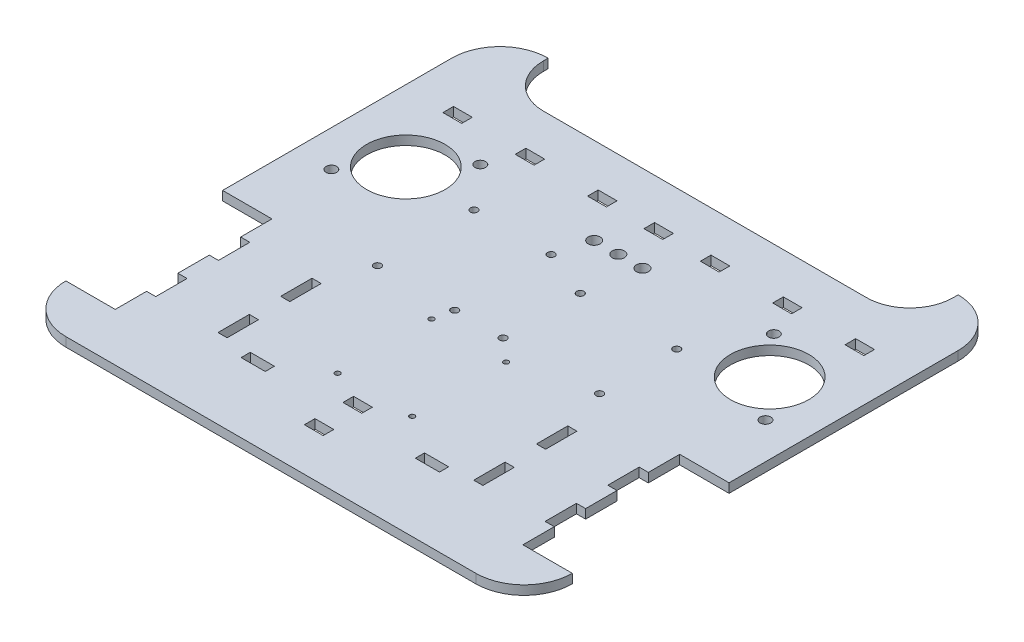
from build123d import *

# Parameters (mm, degrees)
SKETCH1_W           = 266.7
SKETCH1_H           = 254
BOSS_EXTRUDE1_DEPTH = 4.826
SKETCH2_W           = 26.00000007
SKETCH2_H           = 82.55
CUT_EXTRUDE1_DEPTH  = 4.826
CUT_EXTRUDE3_DEPTH  = 4.826
SKETCH7_W           = 215.9
SKETCH7_H           = 25.4
CUT_EXTRUDE5_DEPTH  = 4.826
FILLET9_R           = 22.86
FILLET10_R          = 22.86
CUT_EXTRUDE6_DEPTH  = 4.826
SKETCH10_W          = 4.826
SKETCH10_H          = 16.51
CUT_EXTRUDE8_DEPTH  = 185.213226387
SKETCH12_W          = 4.826
SKETCH12_H          = 16.51
CUT_EXTRUDE9_DEPTH  = 185.213226387
SKETCH13_W          = 4.826
SKETCH13_H          = 16.51
CUT_EXTRUDE10_DEPTH = 185.213226387
SKETCH15_R          = 1.3462
CUT_EXTRUDE11_DEPTH = 185.213226387
SKETCH16_R          = 2.778125
SKETCH16_R_2        = 20.6375
CUT_EXTRUDE12_DEPTH = 185.213226387
SKETCH17_W          = 9.906
SKETCH17_H          = 5.588
CUT_EXTRUDE13_DEPTH = 185.213226387
SKETCH18_W          = 9.906
SKETCH18_H          = 5.588
CUT_EXTRUDE14_DEPTH = 185.213226387
SKETCH19_R          = 3.175
CUT_EXTRUDE15_DEPTH = 185.213226387
SKETCH20_R          = 1.905
CUT_EXTRUDE16_DEPTH = 185.213226387
SKETCH21_R          = 1.905
CUT_EXTRUDE17_DEPTH = 185.213226387
SKETCH22_W          = 12.7
SKETCH22_H          = 4.826
CUT_EXTRUDE18_DEPTH = 185.213226387


with BuildPart() as part:
    # Sketch1 → Boss-Extrude1 (new body)
    with BuildSketch(Plane(origin=(0, 0, 0), x_dir=(1, 0, 0), z_dir=(0, 1, 0))):
        Rectangle(SKETCH1_W, SKETCH1_H)
    extrude(amount=BOSS_EXTRUDE1_DEPTH)

    # Sketch2 → Cut-Extrude1 (cut)
    with BuildSketch(Plane(origin=(0, 4.826, 0), x_dir=(1, 0, 0), z_dir=(0, 1, 0))):
        with Locations((-120.349999965, -60.325)):
            Rectangle(SKETCH2_W, SKETCH2_H)
        with Locations((120.349999965, -60.325)):
            Rectangle(SKETCH2_W, SKETCH2_H)
    extrude(amount=-CUT_EXTRUDE1_DEPTH, mode=Mode.SUBTRACT)

    # Sketch4 → Cut-Extrude3 (cut)
    with BuildSketch(Plane(origin=(0, 4.826, 0), x_dir=(1, 0, 0), z_dir=(0, 1, 0))):
        with BuildLine():
            Line((-133.35, 101.6), (-133.35, 127))
            Line((-133.35, 127), (-107.95, 127))
            ThreePointArc((-107.95, 127), (-125.910512242, 119.560512242), (-133.35, 101.6))
        make_face()
        with BuildLine():
            Line((133.35, 101.6), (133.35, 127))
            Line((133.35, 127), (107.95, 127))
            ThreePointArc((107.95, 127), (125.910512242, 119.560512242), (133.35, 101.6))
        make_face()
    extrude(amount=-CUT_EXTRUDE3_DEPTH, mode=Mode.SUBTRACT)

    # Sketch7 → Cut-Extrude5 (cut)
    with BuildSketch(Plane(origin=(0, 4.826, 0), x_dir=(1, 0, 0), z_dir=(0, 1, 0))):
        with Locations((0, 114.3)):
            Rectangle(SKETCH7_W, SKETCH7_H)
    extrude(amount=-CUT_EXTRUDE5_DEPTH, mode=Mode.SUBTRACT)

    # Fillet9
    fillet9_edges = [part.edges().sort_by_distance(p)[0] for p in [
        (-107.95, 2.413, -101.6),
    ]]
    fillet(fillet9_edges, radius=FILLET9_R)

    # Fillet10
    fillet10_edges = [part.edges().sort_by_distance(p)[0] for p in [
        (107.95, 2.413, -101.6),
    ]]
    fillet(fillet10_edges, radius=FILLET10_R)

    # Sketch8 → Cut-Extrude6 (cut)
    with BuildSketch(Plane(origin=(0, 4.826, 0), x_dir=(1, 0, 0), z_dir=(0, 1, 0))):
        with BuildLine():
            Line((-133.35, -101.6), (-133.35, -127))
            Line((-133.35, -127), (-107.95, -127))
            ThreePointArc((-107.95, -127), (-125.910512242, -119.560512242), (-133.35, -101.6))
        make_face()
        with BuildLine():
            Line((133.35, -127), (107.95, -127))
            ThreePointArc((107.95, -127), (125.910512242, -119.560512242), (133.35, -101.6))
            Line((133.35, -101.6), (133.35, -127))
        make_face()
    extrude(amount=-CUT_EXTRUDE6_DEPTH, mode=Mode.SUBTRACT)

    # Sketch10 → Cut-Extrude8 (cut, through all)
    with BuildSketch(Plane(origin=(0, 4.826, 0), x_dir=(1, 0, 0), z_dir=(0, 1, 0))):
        with Locations((-104.93699993, -76.835)):
            Rectangle(SKETCH10_W, SKETCH10_H)
        with Locations((-104.93699993, -43.815)):
            Rectangle(SKETCH10_W, SKETCH10_H)
        with Locations((104.93699993, -43.815)):
            Rectangle(SKETCH10_W, SKETCH10_H)
        with Locations((104.93699993, -76.835)):
            Rectangle(SKETCH10_W, SKETCH10_H)
    extrude(amount=-CUT_EXTRUDE8_DEPTH, mode=Mode.SUBTRACT)

    # Sketch12 → Cut-Extrude9 (cut, through all)
    with BuildSketch(Plane.XZ):
        with Locations((-67.34499993, 76.835)):
            Rectangle(SKETCH12_W, SKETCH12_H)
        with Locations((-67.34499993, 43.815)):
            Rectangle(SKETCH12_W, SKETCH12_H)
    extrude(amount=-CUT_EXTRUDE9_DEPTH, mode=Mode.SUBTRACT)

    # Sketch13 → Cut-Extrude10 (cut, through all)
    with BuildSketch(Plane(origin=(0, 4.826, 0), x_dir=(1, 0, 0), z_dir=(0, 1, 0))):
        with Locations((67.34499993, -76.835)):
            Rectangle(SKETCH13_W, SKETCH13_H)
        with Locations((67.34499993, -43.815)):
            Rectangle(SKETCH13_W, SKETCH13_H)
    extrude(amount=-CUT_EXTRUDE10_DEPTH, mode=Mode.SUBTRACT)

    # Sketch15 → Cut-Extrude11 (cut, through all)
    with BuildSketch(Plane(origin=(0, 4.826, 0), x_dir=(1, 0, 0), z_dir=(0, 1, 0))):
        with Locations((19.5961, -22.730838906)):
            Circle(SKETCH15_R)
        with Locations((-19.6723, -22.730838906)):
            Circle(SKETCH15_R)
        with Locations((-19.6723, -72.163561094)):
            Circle(SKETCH15_R)
        with Locations((19.5961, -72.163561094)):
            Circle(SKETCH15_R)
    extrude(amount=-CUT_EXTRUDE11_DEPTH, mode=Mode.SUBTRACT)

    # Sketch16 → Cut-Extrude12 (cut, through all)
    with BuildSketch(Plane(origin=(0, 4.826, 0), x_dir=(1, 0, 0), z_dir=(0, 1, 0))):
        with Locations((77.293854564, 60.610218612)):
            Circle(SKETCH16_R)
        with Locations((114.3, 19.164632523)):
            Circle(SKETCH16_R)
        with Locations((95.796927282, 39.887425568)):
            Circle(SKETCH16_R_2)
        with Locations((-95.796927282, 39.887425568)):
            Circle(SKETCH16_R_2)
        with Locations((-77.293854564, 60.610218612)):
            Circle(SKETCH16_R)
        with Locations((-114.3, 19.164632523)):
            Circle(SKETCH16_R)
    extrude(amount=-CUT_EXTRUDE12_DEPTH, mode=Mode.SUBTRACT)

    # Sketch17 → Cut-Extrude13 (cut, through all)
    with BuildSketch(Plane(origin=(0, 4.826, 0), x_dir=(1, 0, 0), z_dir=(0, 1, 0))):
        with Locations((-67.795869789, 77.244822677)):
            Rectangle(SKETCH17_W, SKETCH17_H)
        with Locations((-105.895869789, 77.244822677)):
            Rectangle(SKETCH17_W, SKETCH17_H)
        with Locations((-29.695869789, 77.244822677)):
            Rectangle(SKETCH17_W, SKETCH17_H)
        with Locations((0, 77.244822677)):
            Rectangle(SKETCH17_W, SKETCH17_H)
        with Locations((29.695869789, 77.244822677)):
            Rectangle(SKETCH17_W, SKETCH17_H)
        with Locations((67.795869789, 77.244822677)):
            Rectangle(SKETCH17_W, SKETCH17_H)
        with Locations((105.895869789, 77.244822677)):
            Rectangle(SKETCH17_W, SKETCH17_H)
    extrude(amount=-CUT_EXTRUDE13_DEPTH, mode=Mode.SUBTRACT)

    # Sketch18 → Cut-Extrude14 (cut, through all)
    with BuildSketch(Plane(origin=(0, 4.826, 0), x_dir=(1, 0, 0), z_dir=(0, 1, 0))):
        with Locations((0, -101.6)):
            Rectangle(SKETCH18_W, SKETCH18_H)
        with Locations((0, -81.28)):
            Rectangle(SKETCH18_W, SKETCH18_H)
    extrude(amount=-CUT_EXTRUDE14_DEPTH, mode=Mode.SUBTRACT)

    # Sketch19 → Cut-Extrude15 (cut, through all)
    with BuildSketch(Plane(origin=(0, 4.826, 0), x_dir=(1, 0, 0), z_dir=(0, 1, 0))):
        with Locations((0, 55.982011538)):
            Circle(SKETCH19_R)
        with Locations((12.7, 55.982011538)):
            Circle(SKETCH19_R)
        with Locations((-12.7, 55.982011538)):
            Circle(SKETCH19_R)
    extrude(amount=-CUT_EXTRUDE15_DEPTH, mode=Mode.SUBTRACT)

    # Sketch20 → Cut-Extrude16 (cut, through all)
    with BuildSketch(Plane(origin=(0, 4.826, 0), x_dir=(1, 0, 0), z_dir=(0, 1, 0))):
        with Locations((-58.243854564, 38.202011538)):
            Circle(SKETCH20_R)
        with Locations((-17.603854564, 38.202011538)):
            Circle(SKETCH20_R)
        with Locations((-58.243854564, -12.597988462)):
            Circle(SKETCH20_R)
        with Locations((-17.603854564, -12.597988462)):
            Circle(SKETCH20_R)
    extrude(amount=-CUT_EXTRUDE16_DEPTH, mode=Mode.SUBTRACT)

    # Sketch21 → Cut-Extrude17 (cut, through all)
    with BuildSketch(Plane(origin=(0, 4.826, 0), x_dir=(1, 0, 0), z_dir=(0, 1, 0))):
        with Locations((7.796145436, 28.154731738)):
            Circle(SKETCH21_R)
        with Locations((58.596145436, 28.154731738)):
            Circle(SKETCH21_R)
        with Locations((7.796145436, -12.485268262)):
            Circle(SKETCH21_R)
        with Locations((58.596135632, -12.485268262)):
            Circle(SKETCH21_R)
    extrude(amount=-CUT_EXTRUDE17_DEPTH, mode=Mode.SUBTRACT)

    # Sketch22 → Cut-Extrude18 (cut, through all)
    with BuildSketch(Plane.XZ):
        with Locations((-45.88199993, 88.011)):
            Rectangle(SKETCH22_W, SKETCH22_H)
        with Locations((45.88199993, 88.011)):
            Rectangle(SKETCH22_W, SKETCH22_H)
    extrude(amount=-CUT_EXTRUDE18_DEPTH, mode=Mode.SUBTRACT)


solid = part.part
